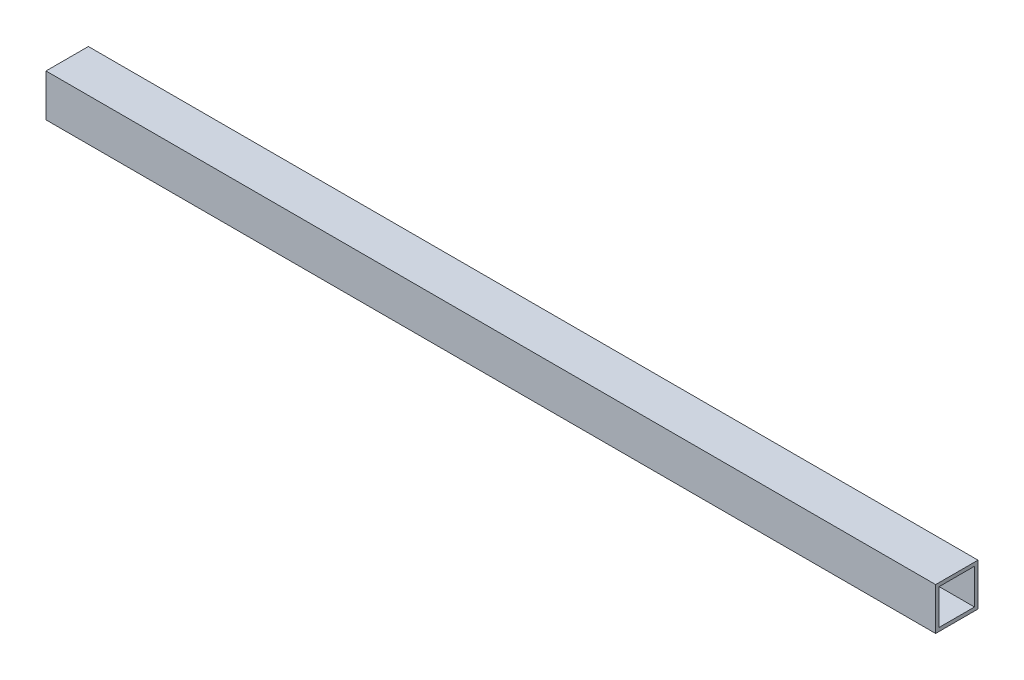
from build123d import *

# Parameters (mm, degrees)
SKETCH1_W           = 38.1
SKETCH1_H           = 38.1
SKETCH1_W_2         = 31.75
SKETCH1_H_2         = 31.75
BOSS_EXTRUDE1_DEPTH = 800.1


with BuildPart() as part:
    # Sketch1 → Boss-Extrude1 (new body)
    with BuildSketch(Plane(origin=(0, 0, 0), x_dir=(0, 0, -1), z_dir=(1, 0, 0))):
        with Locations((19.05, 19.05)):
            Rectangle(SKETCH1_W, SKETCH1_H)
        with Locations((19.05, 19.05)):
            Rectangle(SKETCH1_W_2, SKETCH1_H_2, mode=Mode.SUBTRACT)
    extrude(amount=BOSS_EXTRUDE1_DEPTH)


solid = part.part
